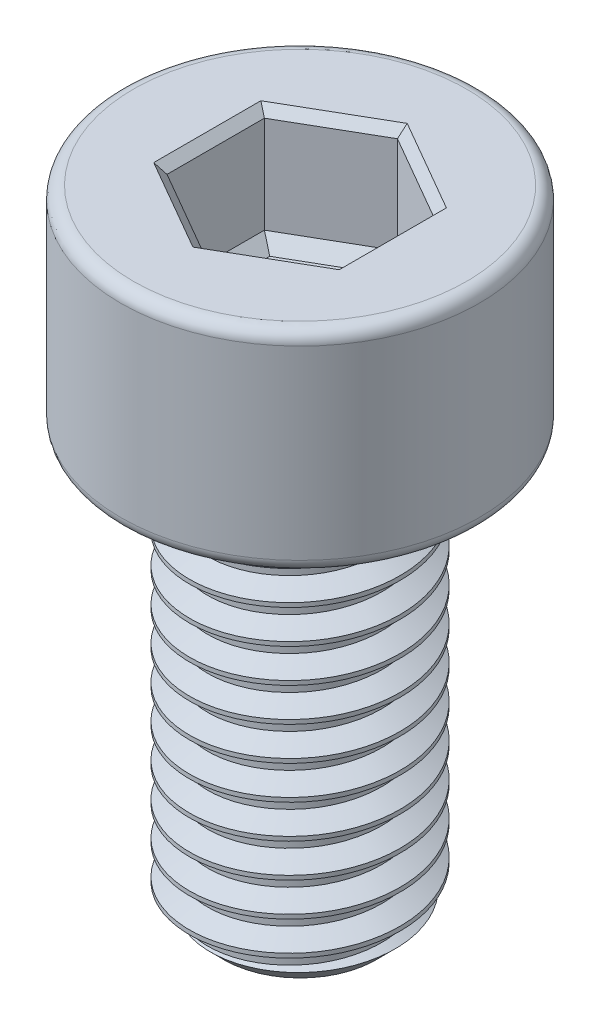
from build123d import *

# Parameters (mm, degrees)
SKETCH1_R           = 2.5
BOSS_EXTRUDE1_DEPTH = 10
THREAD1_PITCH       = 0.8
SKETCH5_R           = 4.25
BOSS_EXTRUDE2_DEPTH = 5
FILLET1_R           = 0.3
CUT_EXTRUDE1_DEPTH  = 2.5
CHAMFER1_SIZE       = 0.2
CUT_EXTRUDE2_DEPTH  = 0.3
CUT_EXTRUDE2_DRAFT  = -45


with BuildPart() as part:
    # Sketch1 → Boss-Extrude1 (new body)
    with BuildSketch(Plane(origin=(0, 0, 0), x_dir=(1, 0, 0), z_dir=(0, 1, 0))):
        with Locations(Location((0, 0, 0), (0, 0, 270))):
            Circle(SKETCH1_R)
    extrude(amount=BOSS_EXTRUDE1_DEPTH)

    # Thread1: the profile of Thread Profile1 profile screwed along a right-hand helix of 13.75 turns, 8 arcs to a turn; built about Z, then put on its axis
    thread1_z = Axis((0, 0, 0), (0, 0, 1))
    thread1_corners = [(2.5003, 0, -0.000173205), (2.5003, 0, 0.700173203), (2.0669873, 0, 0.449999999), (2.0669873, 0, 0.249999999)]
    with BuildLine(mode=Mode.PRIVATE) as thread1_profile:
        Line(thread1_corners[0], thread1_corners[1])
        Line(thread1_corners[1], thread1_corners[2])
        Line(thread1_corners[2], thread1_corners[3])
        Line(thread1_corners[3], thread1_corners[0])
    thread1_cap = Face(thread1_profile.wire())
    thread1_turn_angles = [0, 22.5, 45, 67.5, 90, 112.5, 135, 157.5, 180, 202.5, 225, 247.5, 270, 292.5, 315, 337.5, 360]
    thread1_turn_weights = [1, 0.9238795325112867, 1, 0.9238795325112867, 1, 0.9238795325112867, 1, 0.9238795325112867, 1, 0.9238795325112867, 1, 0.9238795325112867, 1, 0.9238795325112867, 1, 0.9238795325112867, 1]
    thread1_turn_rails = [Edge.make_bspline([Vector(p[0], p[1], 0).rotate(thread1_z, thread1_turn_angles[k]) / thread1_turn_weights[k] + Vector(0, 0, p[2] + THREAD1_PITCH * thread1_turn_angles[k] / 360) for k in range(17)], [0, 0, 0, 1, 1, 2, 2, 3, 3, 4, 4, 5, 5, 6, 6, 7, 7, 8, 8, 8], 2, thread1_turn_weights) for p in thread1_corners]
    thread1_turn_sides = [Face.make_surface_from_curves(thread1_turn_rails[p[0]], thread1_turn_rails[p[1]]) for p in [(0, 1), (1, 2), (2, 3), (3, 0)]]
    thread1_last_angles = [4680, 4702.5, 4725, 4747.5, 4770, 4792.5, 4815, 4837.5, 4860, 4882.5, 4905, 4927.5, 4950]
    thread1_last_weights = [1, 0.9238795325112867, 1, 0.9238795325112867, 1, 0.9238795325112867, 1, 0.9238795325112867, 1, 0.9238795325112867, 1, 0.9238795325112867, 1]
    thread1_last_rails = [Edge.make_bspline([Vector(p[0], p[1], 0).rotate(thread1_z, thread1_last_angles[k]) / thread1_last_weights[k] + Vector(0, 0, p[2] + THREAD1_PITCH * thread1_last_angles[k] / 360) for k in range(13)], [0, 0, 0, 1, 1, 2, 2, 3, 3, 4, 4, 5, 5, 6, 6, 6], 2, thread1_last_weights) for p in thread1_corners]
    thread1_last_sides = [Face.make_surface_from_curves(thread1_last_rails[p[0]], thread1_last_rails[p[1]]) for p in [(0, 1), (1, 2), (2, 3), (3, 0)]]
    thread1 = Plane(origin=(0, 11, 0), x_dir=(-1, 0, 0), z_dir=(0, -1, 0)) * Solid(Shell([*[p.moved(Location((0, 0, THREAD1_PITCH * i))) for i in range(13) for p in thread1_turn_sides], *thread1_last_sides, thread1_cap, thread1_cap.rotate(thread1_z, 4950).moved(Location((0, 0, THREAD1_PITCH * 4950 / 360)))]))
    add(thread1, mode=Mode.SUBTRACT)

    # Sketch5 → Boss-Extrude2 (add)
    with BuildSketch(Plane(origin=(0, 10, 0), x_dir=(1, 0, 0), z_dir=(0, 1, 0))):
        with Locations(Location((0, 0, 0), (0, 0, 270))):
            Circle(SKETCH5_R)
    extrude(amount=BOSS_EXTRUDE2_DEPTH)

    # Fillet1
    fillet1_edges = [part.edges().sort_by_distance(p)[0] for p in [
        (0, 10, -4.25),
        (0, 15, -4.25),
    ]]
    fillet(fillet1_edges, radius=FILLET1_R)

    # Sketch6 → Cut-Revolve1 (revolve, cut)
    with BuildSketch(Plane.XY, mode=Mode.PRIVATE) as cut_revolve1_sk:
        Polygon((2.51, 0), (2.51, 0.7), (1.81, 0), align=None)
    revolve(cut_revolve1_sk.sketch.rotate(Axis((0, 0, 0), (0, 1, 0)), 228.279472978), axis=Axis((0, 0, 0), (0, 1, 0)), mode=Mode.SUBTRACT)

    # Sketch7 → Cut-Extrude1 (cut)
    with BuildSketch(Plane(origin=(0, 15, 0), x_dir=(1, 0, 0), z_dir=(0, 1, 0))):
        Polygon((0, 2.309401077), (-2, 1.154700538), (-2, -1.154700538), (0, -2.309401077), (2, -1.154700538), (2, 1.154700538), align=None)
    extrude(amount=-CUT_EXTRUDE1_DEPTH, mode=Mode.SUBTRACT)

    # Chamfer1
    chamfer1_edges = [part.edges().sort_by_distance(p)[0] for p in [
        (1, 15, -1.732050808),
        (-1, 15, -1.732050808),
        (-2, 15, 0),
        (-1, 15, 1.732050808),
        (1, 15, 1.732050808),
        (2, 15, 0),
    ]]
    chamfer(chamfer1_edges, length=CHAMFER1_SIZE)


with BuildPart() as cut_extrude2_tool:
    # Sketch8 → Cut-Extrude2 (with draft: the straight prism first)
    with BuildSketch(Plane(origin=(0, 12.5, 0), x_dir=(1, 0, 0), z_dir=(0, 1, 0))):
        Polygon((0, 2.309401077), (-2, 1.154700538), (-2, -1.154700538), (0, -2.309401077), (2, -1.154700538), (2, 1.154700538), align=None)
    extrude(amount=-CUT_EXTRUDE2_DEPTH)
    # Cut-Extrude2: the draft: its side faces are tilted about the plane it starts from
    cut_extrude2_sides = [cut_extrude2_tool.faces().sort_by_distance(p)[0] for p in [
        (-1, 12.35, -1.732050808),
        (-2, 12.35, 0),
        (-1, 12.35, 1.732050808),
        (1, 12.35, 1.732050808),
        (2, 12.35, 0),
        (1, 12.35, -1.732050808),
    ]]
    draft(cut_extrude2_sides, Plane(origin=(0, 12.5, 0), x_dir=(1, 0, 0), z_dir=(0, 1, 0)), CUT_EXTRUDE2_DRAFT)


with BuildPart() as part_1:
    add(part.part)

    # Cut-Extrude2: cut by cut_extrude2_tool
    add(cut_extrude2_tool.part, mode=Mode.SUBTRACT)


solid = part_1.part
